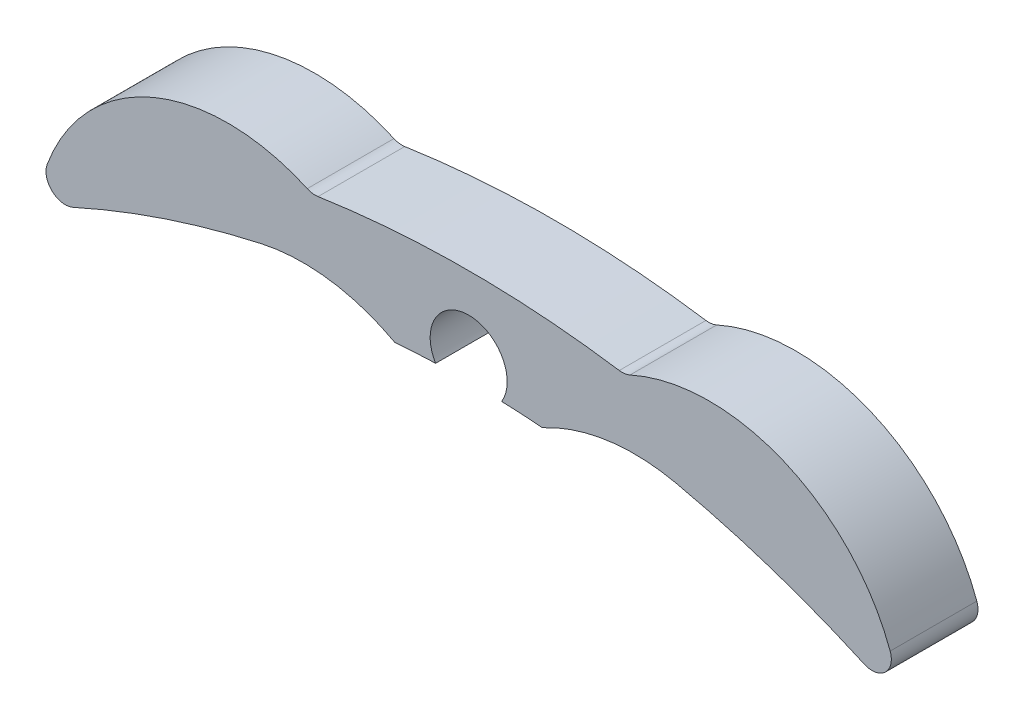
from build123d import *

# Parameters (mm, degrees)
BOSS_EXTRUDE1_DEPTH = 4.5
CUT_EXTRUDE1_DEPTH  = 24.873773295
FILLET1_R           = 10
FILLET2_R           = 1


with BuildPart() as part:
    # Sketch1 → Boss-Extrude1 (new body)
    with BuildSketch(Plane.XY):
        with BuildLine():
            ThreePointArc((1.715540677, -1.028066236), (0, 2), (-1.715540677, -1.028066236))
            ThreePointArc((-1.715540677, -1.028066236), (-12.4000088, -2.631992998), (-22.452233946, -6.592196245))
            ThreePointArc((-22.452233946, -6.592196245), (-18.208029962, 2.594911639), (-8.117877526, 3.372756458))
            ThreePointArc((-8.117877526, 3.372756458), (0, 4), (8.117877526, 3.372756458))
            ThreePointArc((8.117877526, 3.372756458), (18.208029962, 2.594911639), (22.452233946, -6.592196245))
            ThreePointArc((22.452233946, -6.592196245), (12.4000088, -2.631992998), (1.715540677, -1.028066236))
        make_face()
    extrude(amount=BOSS_EXTRUDE1_DEPTH)

    # Sketch2 → Cut-Extrude1 (cut, through all)
    with BuildSketch(Plane.XY.offset(4.5)):
        with BuildLine():
            ThreePointArc((-3.908816698, 0.849206701), (0, -98.692698318), (3.908816698, 0.849206701))
            ThreePointArc((3.908816698, 0.849206701), (0, -4), (-3.908816698, 0.849206701))
        make_face()
    extrude(amount=-CUT_EXTRUDE1_DEPTH, mode=Mode.SUBTRACT)

    # Fillet1
    # the kernel refuses this fillet: 10 mm, written as the material it adds along each edge
    with BuildSketch(Plane(origin=(3.908816698, 0.849206701, 4.5), x_dir=(0.9890559129703541, -0.14754118414320608, 0), z_dir=(0, 0, -1))) as fillet1_piece_1:
        with BuildLine():
            CenterArc((6.236508998, 9.975798703), FILLET1_R, 232.997328349, 40.989656439)
            Line((0.217986376, 1.989724232), (0.097615924, 1.830002743))
            ThreePointArc((0.097615924, 1.830002743), (0.036653136, 1.002787408), (-0.187037265, 0.070831218))
            Line((-0.187037265, 0.070831218), (-0.013905973, -0.199515974))
            ThreePointArc((-0.013905973, -0.199515974), (3.465903834, -0.320637896), (6.945713641, -0.199515974))
            Line((6.945713641, -0.199515974), (6.931807668, 0))
        make_face()
    extrude(amount=4.5)
    with BuildSketch(Plane(origin=(-3.908816698, 0.849206701, 4.5), x_dir=(-0.9890559129703533, -0.14754118414321077, 0), z_dir=(0, 0, -1))) as fillet1_piece_2:
        with BuildLine():
            CenterArc((6.236508998, -9.975798703), FILLET1_R, 86.013015212, 40.989656439)
            Line((0.217986376, -1.989724232), (0.097615924, -1.830002743))
            ThreePointArc((0.097615924, -1.830002743), (0.036653136, -1.002787408), (-0.187037265, -0.070831218))
            Line((-0.187037265, -0.070831218), (-0.013905973, 0.199515974))
            ThreePointArc((-0.013905973, 0.199515974), (3.465903834, 0.320637896), (6.945713641, 0.199515974))
            Line((6.945713641, 0.199515974), (6.931807668, 0))
        make_face()
    extrude(amount=4.5)

    # Fillet2
    fillet2_edges = [part.edges().sort_by_distance(p)[0] for p in [
        (-8.117877526, 3.372756458, 2.25),
        (8.117877526, 3.372756458, 2.25),
        (22.415896296, -4.321740675, 2.25),
        (-22.415896296, -4.321740675, 2.25),
    ]]
    fillet(fillet2_edges, radius=FILLET2_R)


solid = part.part
